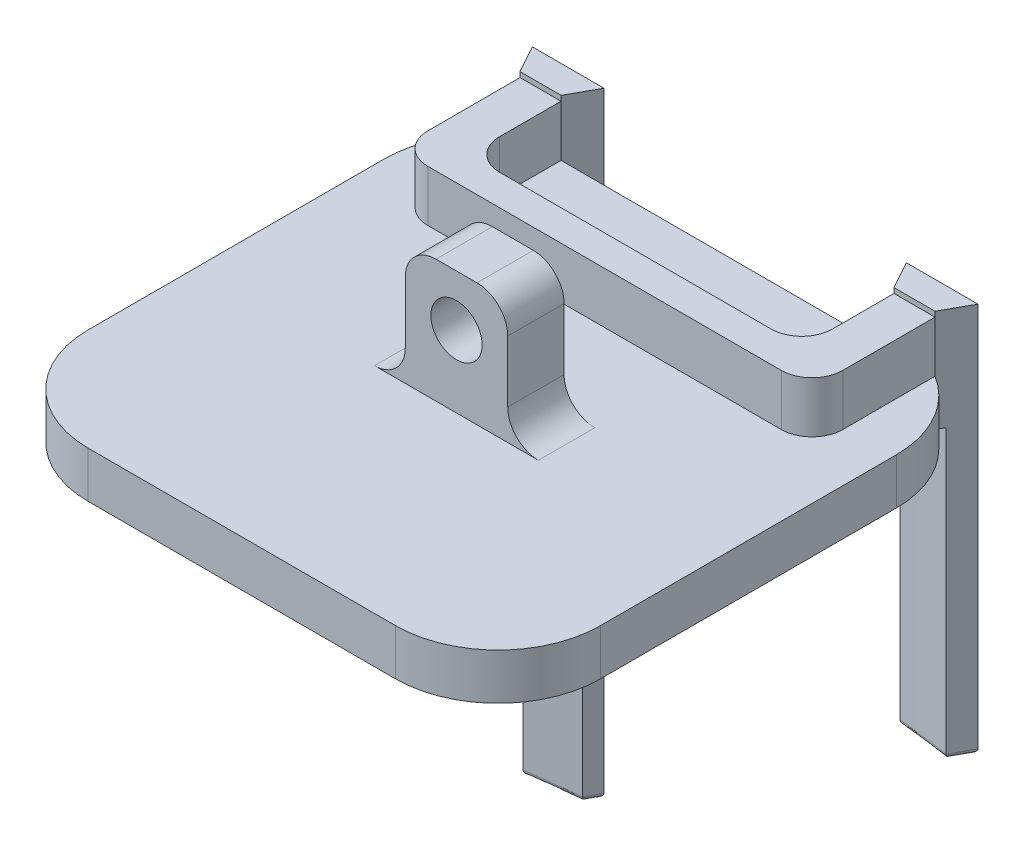
from build123d import *

# Parameters (mm, degrees)
EXTRUDE_1_DEPTH      = 4.5
EXTRUDE_2_DEPTH      = 40
EXTRUDE_2_DEPTH_BACK = 10
CUT_EXTRUDE_1_DEPTH  = 111
FILLET_1_R           = 10
SKETCH_4_W           = 16.25
SKETCH_4_H           = 3
EXTRUDE_3_DEPTH      = 5
FILLET_2_R           = 10
SKETCH_5_W           = 10
SKETCH_5_H           = 5.5
EXTRUDE_4_DEPTH      = 12
SKETCH_6_R           = 2.5
CUT_EXTRUDE_2_DEPTH  = 6
FILLET_3_R           = 3
FILLET_4_R           = 3
EXTRUDE_5_DEPTH      = 10
SKETCH_8_W           = 7
SKETCH_8_H           = 12
CUT_EXTRUDE_3_DEPTH  = 11.8
FILLET_5_R           = 0.4


with BuildPart() as part:
    # 草图1 → 凸台-拉伸1 (new body)
    with BuildSketch(Plane(origin=(0, 0, 0), x_dir=(1, 0, 0), z_dir=(0, 1, 0))):
        Polygon((-25, 23.7), (-25, -23.7), (25, -23.7), (25, 23.7), (20.25, 23.7), (21.75, 26.4), (14.75, 26.4), (16.25, 23.7), (-16.25, 23.7), (-14.75, 26.4), (-21.75, 26.4), (-20.25, 23.7), align=None)
    extrude(amount=EXTRUDE_1_DEPTH)

    # 草图2 → 凸台-拉伸2 (add, two sides: drawn at the far end of the back side and taken through both)
    with BuildSketch(Plane.XZ.offset(-EXTRUDE_2_DEPTH_BACK)):
        Polygon((-20.25, -23.7), (-16.25, -23.7), (-14.75, -26.4), (-21.75, -26.4), align=None)
        Polygon((16.25, -23.7), (20.25, -23.7), (21.75, -26.4), (14.75, -26.4), align=None)
    extrude(amount=EXTRUDE_2_DEPTH + EXTRUDE_2_DEPTH_BACK)

    # 草图3 → 切除-拉伸1 (cut)
    with BuildSketch(Plane.XZ):
        with BuildLine():
            Line((-25, -23.7), (25, -23.7))
            ThreePointArc((25, -23.7), (0, -25.88674251), (-25, -23.7))
        make_face()
    extrude(amount=CUT_EXTRUDE_1_DEPTH, mode=Mode.SUBTRACT)

    # 圆角1
    # the kernel refuses this fillet: 10 mm, written as the material it takes off along each edge
    with BuildSketch(Plane(origin=(25, -21.277555663, -23.7), x_dir=(0, 0, 1), z_dir=(0, 1, 0))) as fillet_1_piece_1:
        with BuildLine():
            CenterArc((8.511022265, -10), FILLET_1_R, 90, 58.331756746)
            Line((0, -4.75), (-0.170220445, -4.645))
            ThreePointArc((-0.170220445, -4.645), (-0.2, -2.375), (-0.2, 0))
            Line((-0.2, 0), (0, 0.2))
            Line((0, 0.2), (8.511022265, 0.2))
            Line((8.511022265, 0.2), (8.511022265, 0))
        make_face()
    extrude(amount=47.055111326, mode=Mode.SUBTRACT)
    with BuildSketch(Plane(origin=(-25, -21.277555663, -23.7), x_dir=(0, 0, 1), z_dir=(0, 1, 0))) as fillet_1_piece_2:
        with BuildLine():
            CenterArc((8.511022265, 10), FILLET_1_R, 211.668243254, 58.331756746)
            Line((0, 4.75), (-0.170220445, 4.645))
            ThreePointArc((-0.170220445, 4.645), (-0.2, 2.375), (-0.2, 0))
            Line((-0.2, 0), (0, -0.2))
            Line((0, -0.2), (8.511022265, -0.2))
            Line((8.511022265, -0.2), (8.511022265, 0))
        make_face()
    extrude(amount=47.055111326, mode=Mode.SUBTRACT)

    # 草图4 → 凸台-拉伸3 (add)
    with BuildSketch(Plane(origin=(0, 4.5, 0), x_dir=(1, 0, 0), z_dir=(0, 1, 0))):
        Polygon((-16.25, 23.7), (-20.25, 23.7), (-20.25, 11.7), (-16.25, 11.7), (-16.25, 14.7), align=None)
        with Locations((-8.125, 13.2)):
            Rectangle(SKETCH_4_W, SKETCH_4_H)
        with Locations((8.125, 13.2)):
            Rectangle(SKETCH_4_W, SKETCH_4_H)
        Polygon((16.25, 14.7), (16.25, 11.7), (20.25, 11.7), (20.25, 23.7), (16.25, 23.7), align=None)
    extrude(amount=EXTRUDE_3_DEPTH)

    # 圆角2
    fillet_2_edges = [part.edges().sort_by_distance(p)[0] for p in [
        (-25, 2.25, 23.7),
        (25, 2.25, 23.7),
    ]]
    fillet(fillet_2_edges, radius=FILLET_2_R)

    # 草图5 → 凸台-拉伸4 (add)
    with BuildSketch(Plane(origin=(0, 4.5, 0), x_dir=(1, 0, 0), z_dir=(0, 1, 0))):
        Rectangle(SKETCH_5_W, SKETCH_5_H)
    extrude(amount=EXTRUDE_4_DEPTH)

    # 草图6 → 切除-拉伸2 (cut)
    with BuildSketch(Plane.XY.offset(2.75)):
        with Locations((0, 11.5)):
            Circle(SKETCH_6_R)
    extrude(amount=-CUT_EXTRUDE_2_DEPTH, mode=Mode.SUBTRACT)

    # 圆角3
    fillet_3_edges = [part.edges().sort_by_distance(p)[0] for p in [
        (5, 4.5, 0),
        (-5, 4.5, 0),
        (5, 16.5, 0),
        (-5, 16.5, 0),
    ]]
    fillet(fillet_3_edges, radius=FILLET_3_R)

    # 圆角4
    fillet_4_edges = [part.edges().sort_by_distance(p)[0] for p in [
        (-16.25, 7, -14.7),
        (-20.25, 7, -11.7),
        (20.25, 7, -11.7),
        (16.25, 7, -14.7),
    ]]
    fillet(fillet_4_edges, radius=FILLET_4_R)

    # 草图7 → 凸台-拉伸5 (add)
    with BuildSketch(Plane.XZ.offset(40)):
        with BuildLine():
            Line((-14.75, -26.4), (-15.499934547, -25.050117816))
            ThreePointArc((-15.499934547, -25.050117816), (-18.072342022, -24.748180462), (-20.638902789, -24.400025019))
            Line((-20.638902789, -24.400025019), (-21.75, -26.4))
            Line((-21.75, -26.4), (-14.75, -26.4))
        make_face()
    extrude(amount=EXTRUDE_5_DEPTH)

    # 草图8 → 切除-拉伸3 (cut)
    with BuildSketch(Plane(origin=(0, 0, -26.4), x_dir=(-1, 0, 0), z_dir=(0, 0, -1))):
        with Locations((-18.25, -34)):
            Rectangle(SKETCH_8_W, SKETCH_8_H)
    extrude(amount=-CUT_EXTRUDE_3_DEPTH, mode=Mode.SUBTRACT)

    # 圆角5
    fillet_5_edges = [part.edges().sort_by_distance(p)[0] for p in [
        (-18.25, -50, -26.4),
        (-15.124967273, -50, -25.725058908),
        (-18.072342022, -50, -24.748180462),
        (-21.194451394, -50, -25.40001251),
        (18.072342022, -28, -24.748180462),
        (21.194451394, -28, -25.40001251),
        (15.124967273, -28, -25.725058908),
        (18.25, -28, -26.4),
    ]]
    fillet(fillet_5_edges, radius=FILLET_5_R)


solid = part.part
